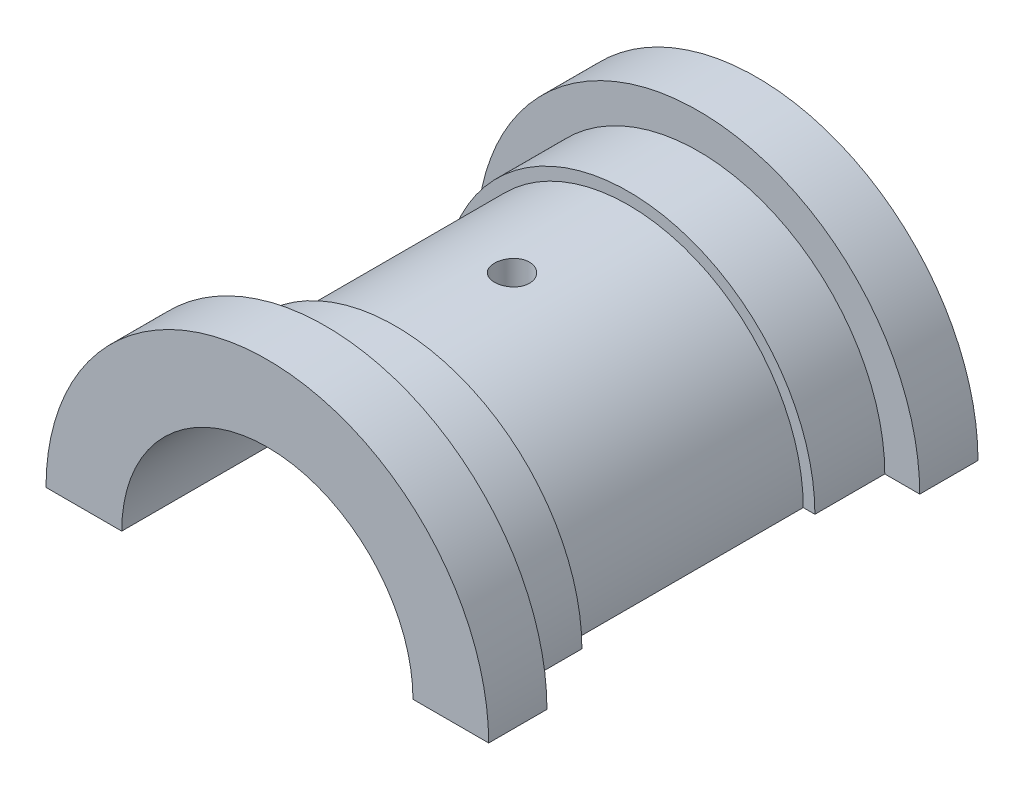
from build123d import *

# Parameters (mm, degrees)
REVOLVE1_START     = -42
REVOLVE1_DEPTH     = 42
REVOLVE1_2_DEPTH   = 10
REVOLVE1_START_2   = -32
REVOLVE1_3_DEPTH   = 12
SKETCH3_R          = 3
CUT_EXTRUDE1_DEPTH = 65.093681436


# Read off the part's stored shape, not the designer's step: Revolve1
with BuildPart() as part:
    # Revolve1 outline → Revolve1 (new body)
    with BuildSketch(Plane.XY.offset(REVOLVE1_START)):
        with BuildLine():
            ThreePointArc((-25, 0), (0, 25), (25, 0))
            Line((25, 0), (30, 0))
            ThreePointArc((30, 0), (0, 30), (-30, 0))
            Line((-30, 0), (-25, 0))
        make_face()
    revolve1 = extrude(amount=REVOLVE1_DEPTH)



with BuildPart() as body_2:
    # Revolve1 2 outline → Revolve1 2 (new body)
    with BuildSketch(Plane.XY.offset(REVOLVE1_START)):
        with BuildLine():
            ThreePointArc((-30, 0), (0, 30), (30, 0))
            Line((30, 0), (38, 0))
            ThreePointArc((38, 0), (0, 38), (-38, 0))
            Line((-38, 0), (-30, 0))
        make_face()
    revolve1_2 = extrude(amount=REVOLVE1_2_DEPTH)


with BuildPart() as part_1:
    add(part.part)

    add(body_2.part)  # Revolve1 3 merges body 2
    # Revolve1 3 outline → Revolve1 3 (add)
    with BuildSketch(Plane.XY.offset(REVOLVE1_START_2)):
        with BuildLine():
            ThreePointArc((-30, 0), (0, 30), (30, 0))
            Line((30, 0), (32, 0))
            ThreePointArc((32, 0), (0, 32), (-32, 0))
            Line((-32, 0), (-30, 0))
        make_face()
    revolve1_3 = extrude(amount=REVOLVE1_3_DEPTH)

    # Mirror1: Revolve1, Revolve1 2, Revolve1 3 across plane
    add(revolve1.mirror(Plane(origin=(30, 0, 0), x_dir=(1, 0, 0), z_dir=(0, 0, -1))))
    add(revolve1_2.mirror(Plane(origin=(30, 0, 0), x_dir=(1, 0, 0), z_dir=(0, 0, -1))))
    add(revolve1_3.mirror(Plane(origin=(30, 0, 0), x_dir=(1, 0, 0), z_dir=(0, 0, -1))))

    # Sketch3 → Cut-Extrude1 (cut, through all)
    with BuildSketch(Plane(origin=(0, 30, 0), x_dir=(1, 0, 0), z_dir=(0, 1, 0))):
        with Locations(Location((0, 0, 0), (0, 0, 270))):
            Circle(SKETCH3_R)
    extrude(amount=-CUT_EXTRUDE1_DEPTH, mode=Mode.SUBTRACT)


solid = part_1.part
